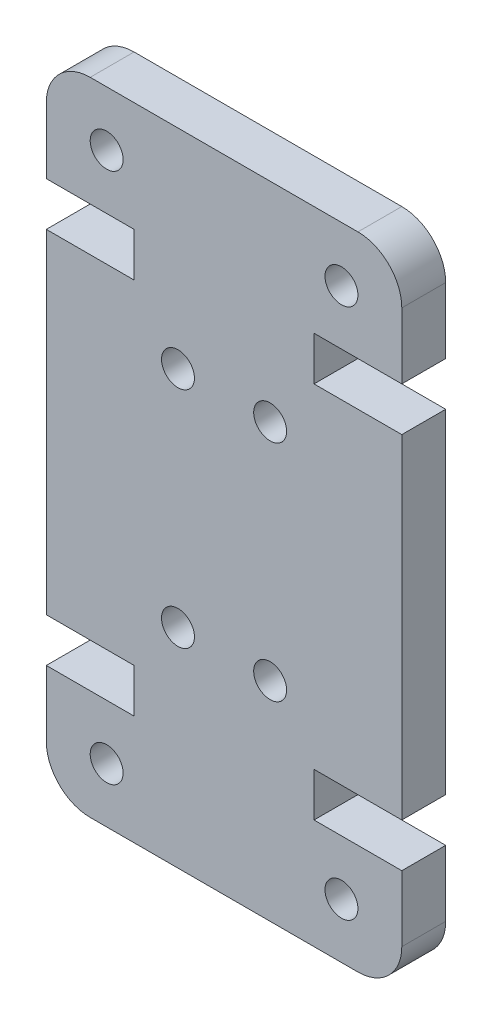
from build123d import *

# Parameters (mm, degrees)
SKETCH1_R           = 0.75
BOSS_EXTRUDE1_DEPTH = 2


with BuildPart() as part:
    # Sketch1 → Boss-Extrude1 (new body)
    with BuildSketch(Plane.XY):
        with BuildLine():
            Line((0, 22.21), (0, 7))
            Line((0, 7), (4, 7))
            Line((4, 7), (4, 5))
            Line((4, 5), (0, 5))
            Line((0, 5), (0, 2))
            ThreePointArc((0, 2), (0.585786438, 0.585786438), (2, 0))
            Line((2, 0), (14.2, 0))
            ThreePointArc((14.2, 0), (15.614213562, 0.585786438), (16.2, 2))
            Line((16.2, 2), (16.2, 5))
            Line((16.2, 5), (12.2, 5))
            Line((12.2, 5), (12.2, 7))
            Line((12.2, 7), (16.2, 7))
            Line((16.2, 7), (16.2, 22.21))
            Line((16.2, 22.21), (12.2, 22.21))
            Line((12.2, 22.21), (12.2, 24.21))
            Line((12.2, 24.21), (16.2, 24.21))
            Line((16.2, 24.21), (16.2, 27.21))
            ThreePointArc((16.2, 27.21), (15.614213562, 28.624213562), (14.2, 29.21))
            Line((14.2, 29.21), (2, 29.21))
            ThreePointArc((2, 29.21), (0.585786438, 28.624213562), (0, 27.21))
            Line((0, 27.21), (0, 24.21))
            Line((0, 24.21), (4, 24.21))
            Line((4, 24.21), (4, 22.21))
            Line((4, 22.21), (0, 22.21))
        make_face()
        with Locations((10.2, 19.71)):
            Circle(SKETCH1_R, mode=Mode.SUBTRACT)
        with Locations((6, 19.71)):
            Circle(SKETCH1_R, mode=Mode.SUBTRACT)
        with Locations((10.2, 9.5)):
            Circle(SKETCH1_R, mode=Mode.SUBTRACT)
        with Locations((6, 9.5)):
            Circle(SKETCH1_R, mode=Mode.SUBTRACT)
        with Locations((13.45, 2.5)):
            Circle(SKETCH1_R, mode=Mode.SUBTRACT)
        with Locations((2.75, 2.5)):
            Circle(SKETCH1_R, mode=Mode.SUBTRACT)
        with Locations((13.45, 26.71)):
            Circle(SKETCH1_R, mode=Mode.SUBTRACT)
        with Locations((2.75, 26.71)):
            Circle(SKETCH1_R, mode=Mode.SUBTRACT)
    extrude(amount=BOSS_EXTRUDE1_DEPTH)


solid = part.part
